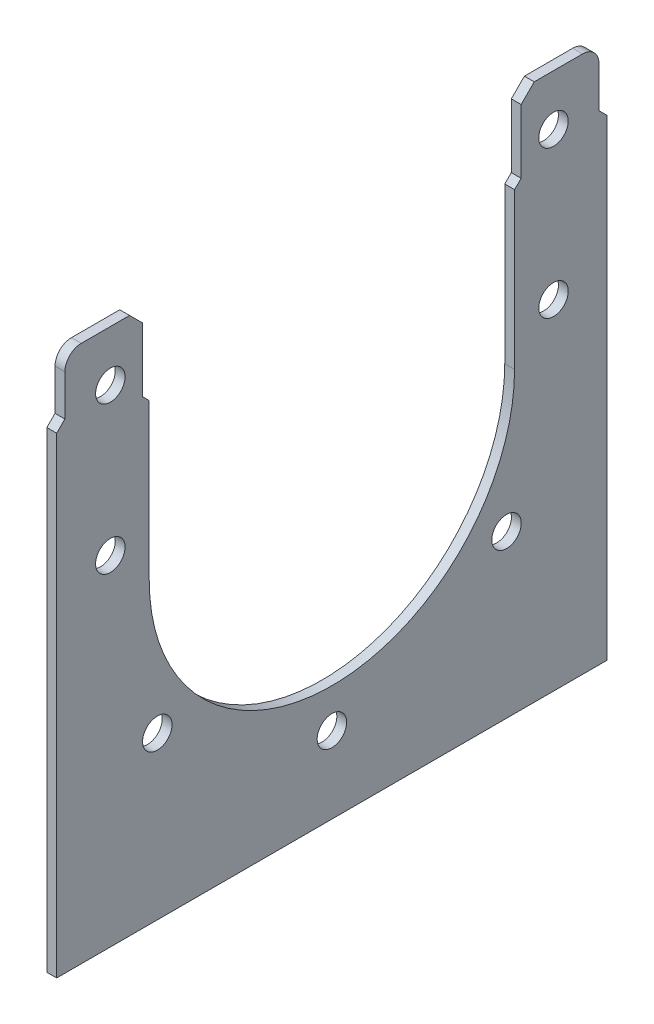
from build123d import *

# Parameters (mm, degrees)
SM_START                 = -3
SM_BASE_FLANGE_1_DEPTH   = 6
SKETCH_6_R               = 9
SKETCH_6_R_2             = 68.5
CUT_EXTRUDE_1_DEPTH      = 248.757946391
CUT_EXTRUDE_2_DEPTH      = 248.703451732
CUT_EXTRUDE_2_DEPTH_BACK = 248.703451732
FILLET_1_R               = 10
CUT_EXTRUDE_3_DEPTH      = 248.703451732
CUT_EXTRUDE_3_DEPTH_BACK = 248.703451732
SKETCH_9_W               = 4
SKETCH_9_H               = 47
CHAMFER_1_SIZE           = 8
CHAMFER_2_SIZE           = 4


# Read off the part's stored shape, not the designer's step: Базовая кромка1
with BuildPart() as part:
    # Базовая кромка1 outline → Базовая кромка1 (new body)
    with BuildSketch(Plane(origin=(0, 0, 0), x_dir=(0, 0, -1), z_dir=(1, 0, 0)).offset(SM_START)):
        with BuildLine():
            Line((-111.5, 0), (-111.5, 146))
            Line((-111.5, 146), (-168, 146))
            Line((-168, 146), (-168, -182))
            Line((-168, -182), (168, -182))
            Line((168, -182), (168, 146))
            Line((168, 146), (111.5, 146))
            Line((111.5, 146), (111.5, 0))
            ThreePointArc((111.5, 0), (0, -111.5), (-111.5, 0))
        make_face()
    extrude(amount=SM_BASE_FLANGE_1_DEPTH)

    # Эскиз6 → Вырез-Вытянуть1 (cut, through all)
    with BuildSketch(Plane(origin=(3, 0, 0), x_dir=(0, 0, -1), z_dir=(1, 0, 0))):
        with Locations((-135.25, 115)):
            Circle(SKETCH_6_R)
        with Locations((-106.578454425, -83.268214538)):
            Circle(SKETCH_6_R)
        with Locations((0, -135.25)):
            Circle(SKETCH_6_R)
        with Locations((106.578454425, -83.268214538)):
            Circle(SKETCH_6_R)
        with Locations((135.25, 115)):
            Circle(SKETCH_6_R)
        Circle(SKETCH_6_R_2)
        with Locations((-135.25, 25)):
            Circle(SKETCH_6_R)
        with Locations((135.25, 25)):
            Circle(SKETCH_6_R)
    extrude(amount=-CUT_EXTRUDE_1_DEPTH, mode=Mode.SUBTRACT)

    # Эскиз8 → Вырез-Вытянуть2 (cut, two sides: drawn at the far end of the back side and taken through both)
    with BuildSketch(Plane(origin=(0, 0, 0), x_dir=(0, 0, -1), z_dir=(1, 0, 0)).offset(-CUT_EXTRUDE_2_DEPTH_BACK)):
        Polygon((-163, 111), (-168, 106), (-168, 111), (-168, 146), (-163, 146), align=None)
        Polygon((168, 146), (163, 146), (163, 111), (168, 106), (168, 111), align=None)
    extrude(amount=CUT_EXTRUDE_2_DEPTH + CUT_EXTRUDE_2_DEPTH_BACK, mode=Mode.SUBTRACT)

    # Скругление1
    fillet_1_edges = [part.edges().sort_by_distance(p)[0] for p in [
        (0, 146, 163),
        (0, 146, -163),
    ]]
    fillet(fillet_1_edges, radius=FILLET_1_R)

    # Эскиз9 → Вырез-Вытянуть3 (cut, two sides: drawn at the far end of the back side and taken through both)
    with BuildSketch(Plane(origin=(0, 0, 0), x_dir=(0, 0, -1), z_dir=(1, 0, 0)).offset(-CUT_EXTRUDE_3_DEPTH_BACK)):
        with Locations((-113.5, 122.5)):
            Rectangle(SKETCH_9_W, SKETCH_9_H)
        with Locations((113.5, 122.5)):
            Rectangle(SKETCH_9_W, SKETCH_9_H)
    extrude(amount=CUT_EXTRUDE_3_DEPTH + CUT_EXTRUDE_3_DEPTH_BACK, mode=Mode.SUBTRACT)

    # Фаска1
    chamfer_1_edges = [part.edges().sort_by_distance(p)[0] for p in [
        (0, 146, 115.5),
        (0, 146, -115.5),
    ]]
    chamfer(chamfer_1_edges, length=CHAMFER_1_SIZE)

    # Фаска2
    chamfer_2_edges = [part.edges().sort_by_distance(p)[0] for p in [
        (0, 99, -111.5),
        (0, 99, 111.5),
    ]]
    chamfer(chamfer_2_edges, length=CHAMFER_2_SIZE - 0.0001)  # a hair under: the kernel refuses the full size


solid = part.part
